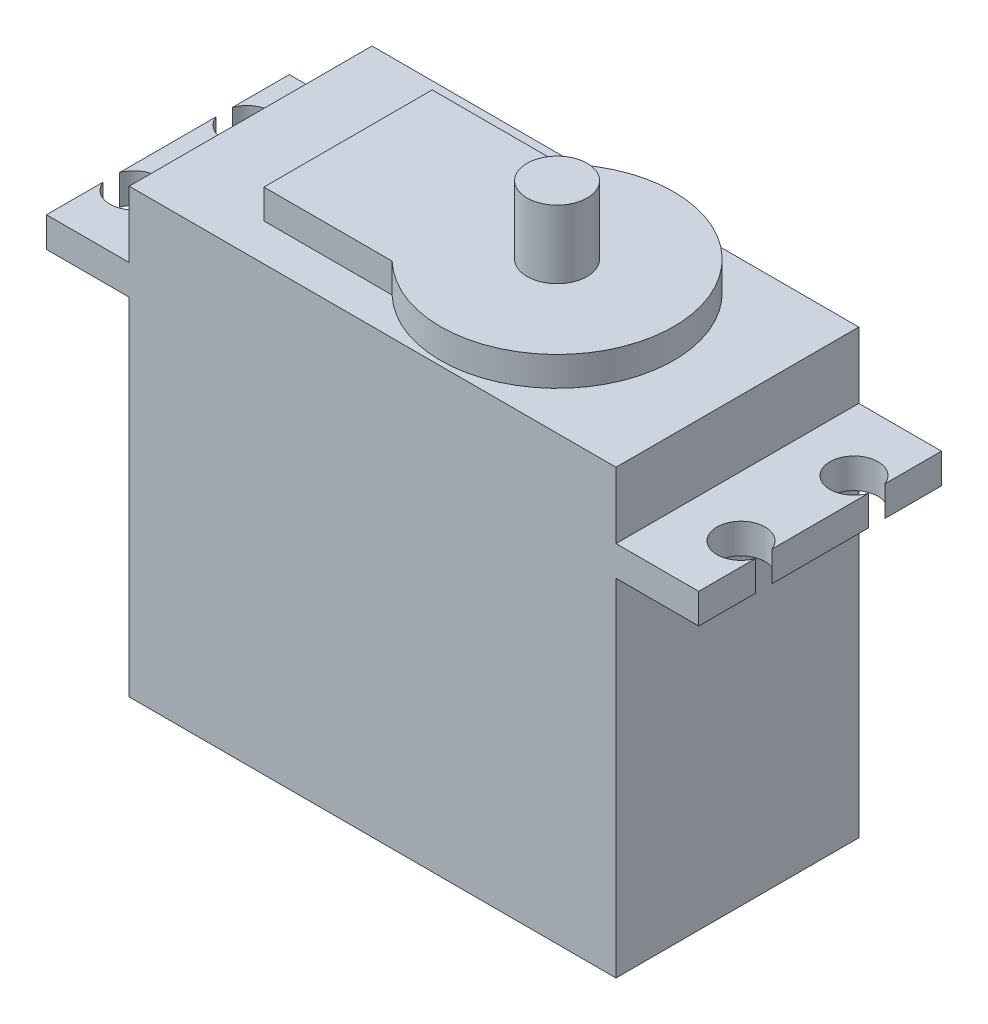
from build123d import *

# Parameters (mm, degrees)
CROQUIS1_W              = 40.5
CROQUIS1_H              = 20.2
SALIENTE_EXTRUIR1_DEPTH = 36.8
SALIENTE_EXTRUIR2_DEPTH = 2.44
CROQUIS3_R              = 2.5
SALIENTE_EXTRUIR3_DEPTH = 5.66
CROQUIS4_W              = 20.2
CROQUIS4_H              = 2.5
SALIENTE_EXTRUIR4_DEPTH = 6.88
CROQUIS5_W              = 20.2
CROQUIS5_H              = 2.5
SALIENTE_EXTRUIR5_DEPTH = 6.88
CORTAR_EXTRUIR1_DEPTH   = 61.271007956


with BuildPart() as part:
    # Croquis1 → Saliente-Extruir1 (new body)
    with BuildSketch(Plane(origin=(0, 0, 0), x_dir=(1, 0, 0), z_dir=(0, 1, 0))):
        with Locations((20.25, 10.1)):
            Rectangle(CROQUIS1_W, CROQUIS1_H)
    extrude(amount=SALIENTE_EXTRUIR1_DEPTH)

    # Croquis2 → Saliente-Extruir2 (add)
    with BuildSketch(Plane(origin=(0, 36.8, 0), x_dir=(1, 0, 0), z_dir=(0, 1, 0))):
        with BuildLine():
            Line((18.770173162, 17.1), (8.106469176, 17.1))
            Line((8.106469176, 17.1), (8.106469176, 3.1))
            Line((8.106469176, 3.1), (18.770173162, 3.1))
            ThreePointArc((18.770173162, 3.1), (35.210333118, 10.1), (18.770173162, 17.1))
        make_face()
    extrude(amount=SALIENTE_EXTRUIR2_DEPTH)

    # Croquis3 → Saliente-Extruir3 (add)
    with BuildSketch(Plane(origin=(0, 39.24, 0), x_dir=(1, 0, 0), z_dir=(0, 1, 0))):
        with Locations((25.5, 10.1)):
            Circle(CROQUIS3_R)
    extrude(amount=SALIENTE_EXTRUIR3_DEPTH)

    # Croquis4 → Saliente-Extruir4 (add)
    with BuildSketch(Plane.ZY):
        with Locations((-10.1, 30.05)):
            Rectangle(CROQUIS4_W, CROQUIS4_H)
    extrude(amount=SALIENTE_EXTRUIR4_DEPTH)

    # Croquis5 → Saliente-Extruir5 (add)
    with BuildSketch(Plane(origin=(40.5, 0, 0), x_dir=(0, 0, -1), z_dir=(1, 0, 0))):
        with Locations((10.1, 30.05)):
            Rectangle(CROQUIS5_W, CROQUIS5_H)
    extrude(amount=SALIENTE_EXTRUIR5_DEPTH)

    # Croquis6 → Cortar-Extruir1 (cut, through all)
    with BuildSketch(Plane(origin=(0, 31.3, 0), x_dir=(1, 0, 0), z_dir=(0, 1, 0))):
        with BuildLine():
            ThreePointArc((-6.88, 14.117651116), (-3, 14.8), (-6.88, 15.482348884))
            Line((-6.88, 15.482348884), (-6.88, 14.117651116))
        make_face()
        with BuildLine():
            ThreePointArc((-6.88, 4.717651116), (-3, 5.4), (-6.88, 6.082348884))
            Line((-6.88, 6.082348884), (-6.88, 4.717651116))
        make_face()
        with BuildLine():
            Line((47.38, 4.717651116), (47.38, 6.082348884))
            ThreePointArc((47.38, 6.082348884), (43.5, 5.4), (47.38, 4.717651116))
        make_face()
        with BuildLine():
            Line((47.38, 14.117651116), (47.38, 15.482348884))
            ThreePointArc((47.38, 15.482348884), (43.5, 14.8), (47.38, 14.117651116))
        make_face()
    extrude(amount=-CORTAR_EXTRUIR1_DEPTH, mode=Mode.SUBTRACT)


solid = part.part
